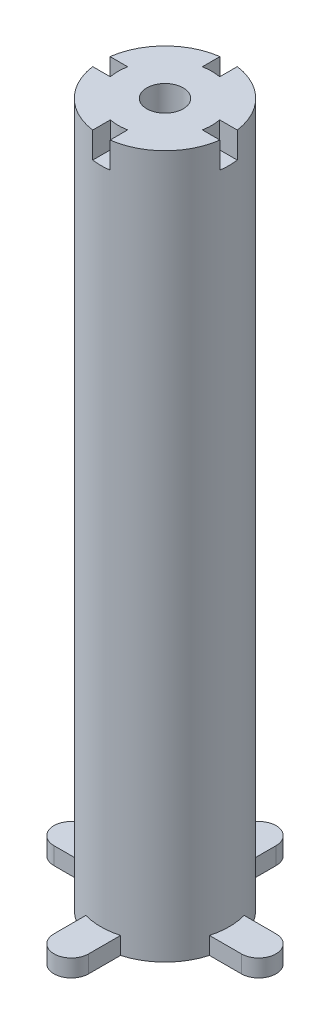
from build123d import *

# Parameters (mm, degrees)
SKETCH_1_R           = 7.4
SKETCH_1_R_2         = 6
EXTRUDE_1_DEPTH      = 78
SKETCH_2_R           = 6
EXTRUDE_2_DEPTH      = 10
EXTRUDE_3_DEPTH      = 2
SKETCH_4_R           = 2.1
CUT_EXTRUDE_1_DEPTH  = 81.072966724
EXTRUDE_4_DEPTH      = 3
EXTRUDE_4_DEPTH_BACK = 10
SKETCH_7_R           = 7.4
CUT_EXTRUDE_START    = -15
SKETCH_11_R          = 2.1
CUT_EXTRUDE_2_DEPTH  = 15
CUT_EXTRUDE_START_2  = -3
CUT_EXTRUDE_3_DEPTH  = 3


with BuildPart() as part:
    # 草图1 → 凸台-拉伸1 (new body)
    with BuildSketch(Plane(origin=(0, 0, 0), x_dir=(1, 0, 0), z_dir=(0, 1, 0))):
        Circle(SKETCH_1_R)
        Circle(SKETCH_1_R_2, mode=Mode.SUBTRACT)
    extrude(amount=EXTRUDE_1_DEPTH)

    # 草图2 → 凸台-拉伸2 (add)
    with BuildSketch(Plane(origin=(0, 0, 0), x_dir=(-1, 0, 0), z_dir=(0, -1, 0))):
        Circle(SKETCH_2_R)
    extrude(amount=-EXTRUDE_2_DEPTH)

    # 草图3 → 凸台-拉伸3 (add)
    with BuildSketch(Plane.XZ):
        with BuildLine():
            Line((-2, 10.8), (-2, 7.124605252))
            ThreePointArc((-2, 7.124605252), (0, 7.4), (2, 7.124605252))
            Line((2, 7.124605252), (2, 10.8))
            ThreePointArc((2, 10.8), (0, 12.8), (-2, 10.8))
        make_face()
        with BuildLine():
            ThreePointArc((-7.124605252, -2), (-7.4, 0), (-7.124605252, 2))
            Line((-7.124605252, 2), (-10.8, 2))
            ThreePointArc((-10.8, 2), (-12.8, 0), (-10.8, -2))
            Line((-10.8, -2), (-7.124605252, -2))
        make_face()
        with BuildLine():
            Line((10.8, 2), (7.124605252, 2))
            ThreePointArc((7.124605252, 2), (7.4, 0), (7.124605252, -2))
            Line((7.124605252, -2), (10.8, -2))
            ThreePointArc((10.8, -2), (12.8, 0), (10.8, 2))
        make_face()
        with BuildLine():
            ThreePointArc((2, -7.124605252), (0, -7.4), (-2, -7.124605252))
            Line((-2, -7.124605252), (-2, -10.8))
            ThreePointArc((-2, -10.8), (0, -12.8), (2, -10.8))
            Line((2, -10.8), (2, -7.124605252))
        make_face()
    extrude(amount=-EXTRUDE_3_DEPTH)

    # 草图4 → 切除-拉伸1 (cut, through all)
    with BuildSketch(Plane.XZ):
        Circle(SKETCH_4_R)
    extrude(amount=-CUT_EXTRUDE_1_DEPTH, mode=Mode.SUBTRACT)

    # 草图7 → 凸台-拉伸4 (add, two sides: drawn at the far end of the back side and taken through both)
    with BuildSketch(Plane(origin=(0, 78, 0), x_dir=(1, 0, 0), z_dir=(0, 1, 0)).offset(-EXTRUDE_4_DEPTH_BACK)):
        Circle(SKETCH_7_R)
    extrude(amount=EXTRUDE_4_DEPTH + EXTRUDE_4_DEPTH_BACK)

    # 草图10 → 切除-旋转15 (revolve, cut)
    with BuildSketch(Plane.XZ.offset(-68)):
        with BuildLine():
            Line((0, -6), (0, 6))
            ThreePointArc((0, 6), (-6, 0), (0, -6))
        make_face()
    revolve(axis=Axis((0, 68, 6), (0, 0, -1)), mode=Mode.SUBTRACT)

    # 草图11 → 切除-拉伸2 (cut)
    with BuildSketch(Plane(origin=(0, 81, 0), x_dir=(1, 0, 0), z_dir=(0, 1, 0)).offset(CUT_EXTRUDE_START)):
        Circle(SKETCH_11_R)
    extrude(amount=CUT_EXTRUDE_2_DEPTH, mode=Mode.SUBTRACT)

    # 草图12 → 切除-拉伸3 (cut)
    with BuildSketch(Plane(origin=(0, 81, 0), x_dir=(1, 0, 0), z_dir=(0, 1, 0)).offset(CUT_EXTRUDE_START_2)):
        with BuildLine():
            Line((5.4, 1), (5.306599665, 1))
            ThreePointArc((5.306599665, 1), (5.4, 0), (5.306599665, -1))
            Line((5.306599665, -1), (5.4, -1))
            Line((5.4, -1), (7.332121112, -1))
            ThreePointArc((7.332121112, -1), (7.4, 0), (7.332121112, 1))
            Line((7.332121112, 1), (5.4, 1))
        make_face()
        with BuildLine():
            Line((-1, 5.4), (-1, 7.332121112))
            ThreePointArc((-1, 7.332121112), (0, 7.4), (1, 7.332121112))
            Line((1, 7.332121112), (1, 5.4))
            Line((1, 5.4), (1, 5.306599665))
            ThreePointArc((1, 5.306599665), (0, 5.4), (-1, 5.306599665))
            Line((-1, 5.306599665), (-1, 5.4))
        make_face()
        with BuildLine():
            Line((1, -5.4), (1, -5.306599665))
            ThreePointArc((1, -5.306599665), (0, -5.4), (-1, -5.306599665))
            Line((-1, -5.306599665), (-1, -5.4))
            Line((-1, -5.4), (-1, -7.332121112))
            ThreePointArc((-1, -7.332121112), (0, -7.4), (1, -7.332121112))
            Line((1, -7.332121112), (1, -5.4))
        make_face()
        with BuildLine():
            Line((-5.4, -1), (-5.306599665, -1))
            ThreePointArc((-5.306599665, -1), (-5.4, 0), (-5.306599665, 1))
            Line((-5.306599665, 1), (-5.4, 1))
            Line((-5.4, 1), (-7.332121112, 1))
            ThreePointArc((-7.332121112, 1), (-7.4, 0), (-7.332121112, -1))
            Line((-7.332121112, -1), (-5.4, -1))
        make_face()
    extrude(amount=CUT_EXTRUDE_3_DEPTH, mode=Mode.SUBTRACT)


solid = part.part
